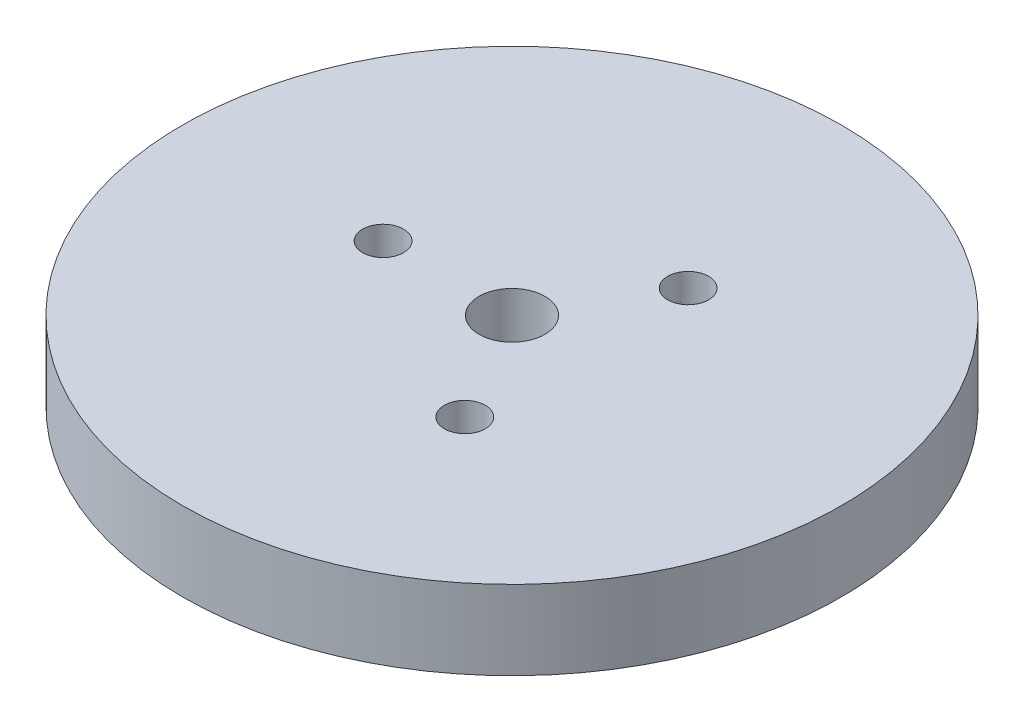
from build123d import *

# Parameters (mm, degrees)
SKETCH1_R           = 75
BOSS_EXTRUDE1_DEPTH = 18
SKETCH2_R           = 7.5
CUT_EXTRUDE1_DEPTH  = 108.582526462
SKETCH3_R           = 4.65146481
CUT_EXTRUDE2_DEPTH  = 14.103153358
CIRPATTERN1_COUNT   = 3


with BuildPart() as part:
    # Sketch1 → Boss-Extrude1 (new body)
    with BuildSketch(Plane(origin=(0, 0, 0), x_dir=(1, 0, 0), z_dir=(0, 1, 0))):
        Circle(SKETCH1_R)
    extrude(amount=BOSS_EXTRUDE1_DEPTH)

    # Sketch2 → Cut-Extrude1 (cut, through all)
    with BuildSketch(Plane(origin=(0, 0, 0), x_dir=(1, 0, 0), z_dir=(0, 1, 0))):
        Circle(SKETCH2_R)
    extrude(amount=CUT_EXTRUDE1_DEPTH, mode=Mode.SUBTRACT)

    # Sketch3 → Cut-Extrude2 (cut)
    with BuildSketch(Plane(origin=(0, 18, 0), x_dir=(1, 0, 0), z_dir=(0, 1, 0))):
        with Locations((-29.342695651, 0)):
            Circle(SKETCH3_R)
    cut_extrude2 = extrude(amount=-CUT_EXTRUDE2_DEPTH, mode=Mode.SUBTRACT)

    # CirPattern1: Cut-Extrude2 ×3 about axis
    cirpattern1_axis = Axis((0, 0, 0), (0, 1, 0))
    for i in range(1, CIRPATTERN1_COUNT):
        add(cut_extrude2.rotate(cirpattern1_axis, i * 360 / CIRPATTERN1_COUNT), mode=Mode.SUBTRACT)


solid = part.part
